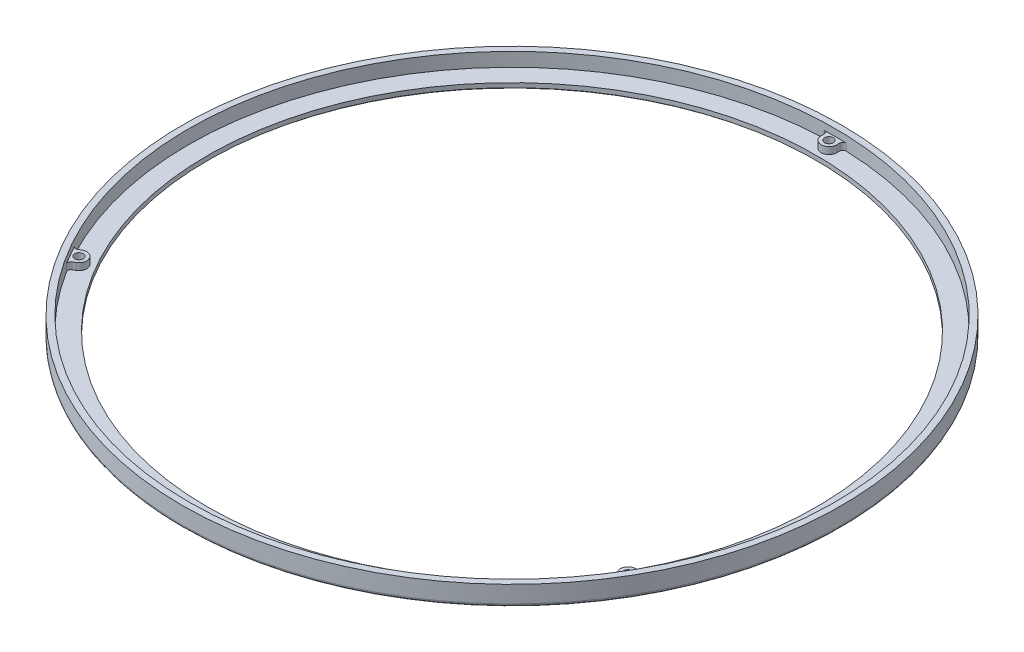
from build123d import *

# Parameters (mm, degrees)
SKETCH_1_R          = 52.5
SKETCH_1_R_2        = 48.5
EXTRUDE_1_DEPTH     = 3.2
SKETCH_2_R          = 51.5
CUT_EXTRUDE_1_DEPTH = 2.2
SKETCH_3_R          = 1.25
EXTRUDE_2_DEPTH     = 1.1
EXTRUDE_3_DEPTH     = 1.1
SKETCH_5_R          = 0.7
CUT_EXTRUDE_2_DEPTH = 75.315139776
SKETCH_6_R          = 1.5
CUT_EXTRUDE_3_DEPTH = 0.7
FILLET_1_R          = 0.5
CHAMFER_1_SIZE      = 0.3
CHAMFER_1_SIZE2     = 0.357526078


with BuildPart() as part:
    # 草图1 → 凸台-拉伸1 (new body)
    with BuildSketch(Plane(origin=(0, 0, 0), x_dir=(1, 0, 0), z_dir=(0, 1, 0))):
        with Locations(Location((0, 0, 0), (0, 0, 270))):
            Circle(SKETCH_1_R)
        with Locations(Location((0, 0, 0), (0, 0, 270))):
            Circle(SKETCH_1_R_2, mode=Mode.SUBTRACT)
    extrude(amount=EXTRUDE_1_DEPTH)

    # 草图2 → 切除-拉伸1 (cut)
    with BuildSketch(Plane(origin=(0, 3.2, 0), x_dir=(1, 0, 0), z_dir=(0, 1, 0))):
        with Locations(Location((0, 0, 0), (0, 0, 270))):
            Circle(SKETCH_2_R)
    extrude(amount=-CUT_EXTRUDE_1_DEPTH, mode=Mode.SUBTRACT)

    # 草图3 → 凸台-拉伸2 (add)
    with BuildSketch(Plane(origin=(0, 1, 0), x_dir=(1, 0, 0), z_dir=(0, 1, 0))):
        with Locations((-43.734282891, -25.25)):
            Circle(SKETCH_3_R)
        with Locations((43.734282891, -25.25)):
            Circle(SKETCH_3_R)
        with Locations((0, 50.5)):
            Circle(SKETCH_3_R)
    extrude(amount=EXTRUDE_2_DEPTH)

    # 草图4 → 凸台-拉伸3 (add)
    with BuildSketch(Plane(origin=(0, 1, 0), x_dir=(1, 0, 0), z_dir=(0, 1, 0))):
        with BuildLine():
            ThreePointArc((-44.974169566, -25.09131467), (-44.774871009, -24.557413277), (-44.359282891, -24.167468245))
            Line((-44.359282891, -24.167468245), (-45.225308295, -24.667468245))
            Line((-45.225308295, -24.667468245), (-44.600307976, -25.750000552))
            ThreePointArc((-44.600307976, -25.750000552), (-44.788449666, -25.4213449), (-44.974169566, -25.09131467))
        make_face()
        with BuildLine():
            Line((-43.975308295, -26.832531755), (-43.109282891, -26.332531755))
            ThreePointArc((-43.109282891, -26.332531755), (-43.654779254, -26.497469106), (-44.216800701, -26.403116023))
            ThreePointArc((-44.216800701, -26.403116023), (-44.409754992, -26.077263307), (-44.600307976, -25.750000552))
            Line((-44.600307976, -25.750000552), (-43.975308295, -26.832531755))
        make_face()
        with BuildLine():
            Line((-1.59e-07, 51.5), (-1.25, 51.5))
            Line((-1.25, 51.5), (-1.25, 50.5))
            ThreePointArc((-1.25, 50.5), (-1.120091755, 51.054882384), (-0.757368864, 51.494430693))
            ThreePointArc((-0.757368864, 51.494430693), (-0.37869475, 51.498607654), (-1.59e-07, 51.5))
        make_face()
        with BuildLine():
            Line((1.25, 51.5), (-1.59e-07, 51.5))
            ThreePointArc((-1.59e-07, 51.5), (0.378694591, 51.498607655), (0.757368864, 51.494430693))
            ThreePointArc((0.757368864, 51.494430693), (1.120091755, 51.054882384), (1.25, 50.5))
            Line((1.25, 50.5), (1.25, 51.5))
        make_face()
        with BuildLine():
            Line((45.225308295, -24.667468245), (44.359282891, -24.167468245))
            ThreePointArc((44.359282891, -24.167468245), (44.774871009, -24.557413277), (44.974169566, -25.09131467))
            ThreePointArc((44.974169566, -25.09131467), (44.788449793, -25.421344676), (44.600308233, -25.750000108))
            Line((44.600308233, -25.750000108), (45.225308295, -24.667468245))
        make_face()
        with BuildLine():
            ThreePointArc((44.216800701, -26.403116023), (43.654779254, -26.497469107), (43.109282891, -26.332531755))
            Line((43.109282891, -26.332531755), (43.975308295, -26.832531755))
            Line((43.975308295, -26.832531755), (44.600308233, -25.750000108))
            ThreePointArc((44.600308233, -25.750000108), (44.409755121, -26.077263086), (44.216800701, -26.403116023))
        make_face()
    extrude(amount=EXTRUDE_3_DEPTH)

    # 草图5 → 切除-拉伸2 (cut, through all)
    with BuildSketch(Plane(origin=(0, 3.2, 0), x_dir=(1, 0, 0), z_dir=(0, 1, 0))):
        with Locations(Location((0, 50.5, 0), (0, 0, 270))):
            Circle(SKETCH_5_R)
        with Locations(Location((-43.734282891, -25.25, 0), (0, 0, 270))):
            Circle(SKETCH_5_R)
        with Locations(Location((43.734282891, -25.25, 0), (0, 0, 270))):
            Circle(SKETCH_5_R)
    extrude(amount=-CUT_EXTRUDE_2_DEPTH, mode=Mode.SUBTRACT)

    # 草图6 → 切除-拉伸3 (cut)
    with BuildSketch(Plane.XZ):
        with Locations(Location((-43.734282891, 25.25, 0), (0, 0, 270))):
            Circle(SKETCH_6_R)
        with Locations(Location((0, -50.5, 0), (0, 0, 270))):
            Circle(SKETCH_6_R)
        with Locations(Location((43.734282891, 25.25, 0), (0, 0, 270))):
            Circle(SKETCH_6_R)
    extrude(amount=-CUT_EXTRUDE_3_DEPTH, mode=Mode.SUBTRACT)

    # 圆角1
    fillet_1_edges = [part.edges().sort_by_distance(p)[0] for p in [
        (0, 0, -52.5),
        (-43.962168838, 1.55, 26.824945686),
        (-45.212168838, 1.55, 24.659882176),
        (-1.25, 1.55, -51.484827862),
        (1.25, 1.55, -51.484827862),
        (45.212168838, 1.55, 24.659882176),
        (43.962168838, 1.55, 26.824945686),
    ]]
    fillet(fillet_1_edges, radius=FILLET_1_R - 0.0001)  # a hair under: the kernel refuses the full size

    # 倒角1
    chamfer_1_edges = [part.edges().sort_by_distance(p)[0] for p in [
        (0, 0, -48.5),
    ]]
    chamfer_1_side = [part.faces().sort_by_distance(p)[0] for p in [
        (0, 0.5, -48.5),
    ]]
    chamfer(chamfer_1_edges, length=CHAMFER_1_SIZE, length2=CHAMFER_1_SIZE2, reference=chamfer_1_side[0])


solid = part.part
